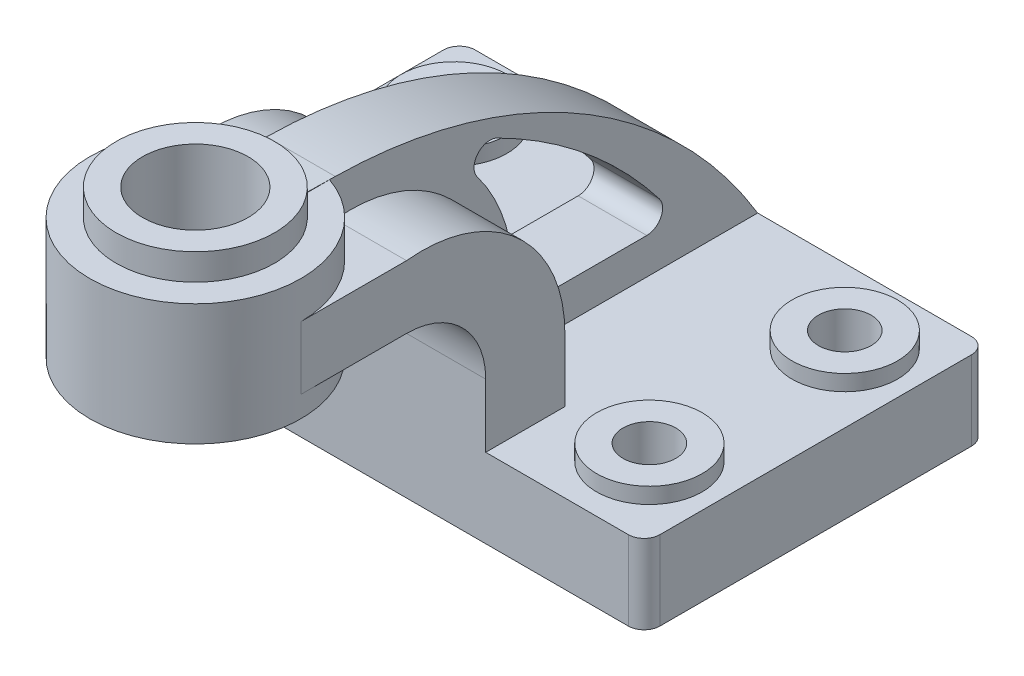
from build123d import *

# Parameters (mm, degrees)
SKETCH5_R                = 254
SKETCH5_R_2              = 127
BOSS_EXTRUDE2_DEPTH      = 381
BOSS_EXTRUDE3_START      = 76.2
SKETCH5_5_R              = 254
SKETCH5_5_R_2            = 127
BOSS_EXTRUDE3_DEPTH      = 76.2
SKETCH6_R                = 508
SKETCH6_R_2              = 381
BOSS_EXTRUDE4_DEPTH      = 584.2
BOSS_EXTRUDE5_DEPTH      = 127
BOSS_EXTRUDE5_DEPTH_BACK = 584.2
BOSS_EXTRUDE6_DEPTH      = 508
BOSS_EXTRUDE6_DEPTH_BACK = 508
CUT_EXTRUDE1_DEPTH       = 2904.34744305
RIB1_START               = -165.1
RIB1_DEPTH               = 330.2
CUT_EXTRUDE2_DEPTH       = 508
CUT_EXTRUDE2_DEPTH_BACK  = 508


# Read off the part's stored shape, not the designer's step: Rib1
with BuildPart() as part:
    # Sketch5 → Boss-Extrude2 (new body)
    # profile 1 of 5: a face of its own
    with BuildSketch(Plane(origin=(0, 0, 0), x_dir=(1, 0, 0), z_dir=(0, 1, 0))):
        with BuildLine():
            Line((-1193.8, -825.5), (1193.8, -825.5))
            ThreePointArc((1193.8, -825.5), (1247.681536726, -803.181536726), (1270, -749.3))
            Line((1270, -749.3), (1270, 749.3))
            ThreePointArc((1270, 749.3), (1247.681536726, 803.181536726), (1193.8, 825.5))
            Line((1193.8, 825.5), (-1193.8, 825.5))
            ThreePointArc((-1193.8, 825.5), (-1247.681536726, 803.181536726), (-1270, 749.3))
            Line((-1270, 749.3), (-1270, -749.3))
            ThreePointArc((-1270, -749.3), (-1247.681536726, -803.181536726), (-1193.8, -825.5))
        make_face()
        with Locations((939.8, -469.9)):
            Circle(SKETCH5_R, mode=Mode.SUBTRACT)
        with Locations((-939.8, 469.9)):
            Circle(SKETCH5_R, mode=Mode.SUBTRACT)
        with Locations((939.8, 469.9)):
            Circle(SKETCH5_R, mode=Mode.SUBTRACT)
        with Locations((-939.8, -469.9)):
            Circle(SKETCH5_R, mode=Mode.SUBTRACT)
    # profile 2 of 5: a face of its own
    with BuildSketch(Plane(origin=(0, 0, 0), x_dir=(1, 0, 0), z_dir=(0, 1, 0))):
        with Locations((-939.8, 469.9)):
            Circle(SKETCH5_R)
        with Locations(Location((-939.8, 469.9, 0), (0, 0, 270))):
            Circle(SKETCH5_R_2, mode=Mode.SUBTRACT)
    # profile 3 of 5: a face of its own
    with BuildSketch(Plane(origin=(0, 0, 0), x_dir=(1, 0, 0), z_dir=(0, 1, 0))):
        with Locations((-939.8, -469.9)):
            Circle(SKETCH5_R)
        with Locations(Location((-939.8, -469.9, 0), (0, 0, 270))):
            Circle(SKETCH5_R_2, mode=Mode.SUBTRACT)
    # profile 4 of 5: a face of its own
    with BuildSketch(Plane(origin=(0, 0, 0), x_dir=(1, 0, 0), z_dir=(0, 1, 0))):
        with Locations((939.8, -469.9)):
            Circle(SKETCH5_R)
        with Locations(Location((939.8, -469.9, 0), (0, 0, 270))):
            Circle(SKETCH5_R_2, mode=Mode.SUBTRACT)
    # profile 5 of 5: a face of its own
    with BuildSketch(Plane(origin=(0, 0, 0), x_dir=(1, 0, 0), z_dir=(0, 1, 0))):
        with Locations((939.8, 469.9)):
            Circle(SKETCH5_R)
        with Locations(Location((939.8, 469.9, 0), (0, 0, 270))):
            Circle(SKETCH5_R_2, mode=Mode.SUBTRACT)
    extrude(amount=-BOSS_EXTRUDE2_DEPTH)

    # Sketch5<5> → Boss-Extrude3 (add)
    # profile 1 of 4: a face of its own
    with BuildSketch(Plane(origin=(0, 0, 0), x_dir=(1, 0, 0), z_dir=(0, 1, 0)).offset(BOSS_EXTRUDE3_START)):
        with Locations(Location((-939.8, 469.9, 0), (0, 0, 90))):
            Circle(SKETCH5_5_R)
        with Locations(Location((-939.8, 469.9, 0), (0, 0, 270))):
            Circle(SKETCH5_5_R_2, mode=Mode.SUBTRACT)
    # profile 2 of 4: a face of its own
    with BuildSketch(Plane(origin=(0, 0, 0), x_dir=(1, 0, 0), z_dir=(0, 1, 0)).offset(BOSS_EXTRUDE3_START)):
        with Locations(Location((-939.8, -469.9, 0), (0, 0, 90))):
            Circle(SKETCH5_5_R)
        with Locations(Location((-939.8, -469.9, 0), (0, 0, 270))):
            Circle(SKETCH5_5_R_2, mode=Mode.SUBTRACT)
    # profile 3 of 4: a face of its own
    with BuildSketch(Plane(origin=(0, 0, 0), x_dir=(1, 0, 0), z_dir=(0, 1, 0)).offset(BOSS_EXTRUDE3_START)):
        with Locations(Location((939.8, 469.9, 0), (0, 0, 90))):
            Circle(SKETCH5_5_R)
        with Locations(Location((939.8, 469.9, 0), (0, 0, 270))):
            Circle(SKETCH5_5_R_2, mode=Mode.SUBTRACT)
    # profile 4 of 4: a face of its own
    with BuildSketch(Plane(origin=(0, 0, 0), x_dir=(1, 0, 0), z_dir=(0, 1, 0)).offset(BOSS_EXTRUDE3_START)):
        with Locations(Location((939.8, -469.9, 0), (0, 0, 90))):
            Circle(SKETCH5_5_R)
        with Locations(Location((939.8, -469.9, 0), (0, 0, 270))):
            Circle(SKETCH5_5_R_2, mode=Mode.SUBTRACT)
    extrude(amount=-BOSS_EXTRUDE3_DEPTH)



with BuildPart() as body_2:
    # Sketch6 → Boss-Extrude4 (new body)
    with BuildSketch(Plane(origin=(0, 1168.4, 0), x_dir=(1, 0, 0), z_dir=(0, 1, 0))):
        with Locations(Location((0, -1714.5, 0), (0, 0, 270))):
            Circle(SKETCH6_R)
        with Locations(Location((0, -1714.5, 0), (0, 0, 270))):
            Circle(SKETCH6_R_2, mode=Mode.SUBTRACT)
    extrude(amount=-BOSS_EXTRUDE4_DEPTH)

    # Sketch6<5> → Boss-Extrude5 (add, two sides: drawn at the far end of the back side and taken through both)
    with BuildSketch(Plane(origin=(0, 1168.4, 0), x_dir=(1, 0, 0), z_dir=(0, 1, 0)).offset(-BOSS_EXTRUDE5_DEPTH_BACK)):
        with BuildLine():
            ThreePointArc((381, -1714.5), (269.407683632, -1445.092316368), (0, -1333.5))
            Line((0, -1333.5), (0, -1460.5))
            ThreePointArc((0, -1460.5), (179.605122421, -1534.894877579), (254, -1714.5))
            ThreePointArc((254, -1714.5), (179.605122421, -1894.105122421), (0, -1968.5))
            Line((0, -1968.5), (0, -2095.5))
            ThreePointArc((0, -2095.5), (269.407683632, -1983.907683632), (381, -1714.5))
        make_face()
        with BuildLine():
            Line((0, -1460.5), (0, -1333.5))
            ThreePointArc((0, -1333.5), (-381, -1714.5), (0, -2095.5))
            Line((0, -2095.5), (0, -1968.5))
            ThreePointArc((0, -1968.5), (-254, -1714.5), (0, -1460.5))
        make_face()
        with BuildLine():
            ThreePointArc((381, -1714.5), (269.407683632, -1445.092316368), (0, -1333.5))
            Line((0, -1333.5), (0, -1460.5))
            ThreePointArc((0, -1460.5), (179.605122421, -1534.894877579), (254, -1714.5))
            ThreePointArc((254, -1714.5), (179.605122421, -1894.105122421), (0, -1968.5))
            Line((0, -1968.5), (0, -2095.5))
            ThreePointArc((0, -2095.5), (269.407683632, -1983.907683632), (381, -1714.5))
        make_face()
        with BuildLine():
            Line((0, -1460.5), (0, -1333.5))
            ThreePointArc((0, -1333.5), (-381, -1714.5), (0, -2095.5))
            Line((0, -2095.5), (0, -1968.5))
            ThreePointArc((0, -1968.5), (-254, -1714.5), (0, -1460.5))
        make_face()
    extrude(amount=BOSS_EXTRUDE5_DEPTH + BOSS_EXTRUDE5_DEPTH_BACK)


with BuildPart() as part_1:
    add(part.part)

    add(body_2.part)  # Boss-Extrude6 merges body 2
    # Sketch11 → Boss-Extrude6 (add, two sides: drawn at the far end of the back side and taken through both)
    with BuildSketch(Plane(origin=(0, 0, 0), x_dir=(0, 0, -1), z_dir=(1, 0, 0)).offset(-BOSS_EXTRUDE6_DEPTH_BACK)):
        with BuildLine():
            Line((-825.5, 0), (-825.5, 304.8))
            ThreePointArc((-825.5, 304.8), (-937.092316368, 574.207683632), (-1206.5, 685.8))
            Line((-1206.5, 685.8), (-1714.5, 685.8))
            Line((-1714.5, 685.8), (-1714.5, 989.043840563))
            Line((-1714.5, 989.043840563), (-1206.5, 989.043840563))
            ThreePointArc((-1206.5, 989.043840563), (-672.998317557, 816.80529258), (-444.654841735, 304.8))
            Line((-444.654841735, 304.8), (-444.654841735, 0))
            Line((-444.654841735, 0), (-825.5, 0))
        make_face()
    extrude(amount=BOSS_EXTRUDE6_DEPTH + BOSS_EXTRUDE6_DEPTH_BACK)

    # Sketch12 → Cut-Extrude1 (cut, through all)
    with BuildSketch(Plane(origin=(0, 989.043840563, 0), x_dir=(1, 0, 0), z_dir=(0, 1, 0))):
        with BuildLine():
            Line((-254, -1714.5), (254, -1714.5))
            ThreePointArc((254, -1714.5), (0, -1460.5), (-254, -1714.5))
        make_face()
    extrude(amount=-CUT_EXTRUDE1_DEPTH, mode=Mode.SUBTRACT)

    # Rib1 outline → Rib1 (add)
    with BuildSketch(Plane(origin=(0, 0, 0), x_dir=(0, 0, -1), z_dir=(1, 0, 0)).offset(RIB1_START)):
        with BuildLine():
            Line((-1373, 1170.843638094), (-1373, 971.12248932))
            Line((-1373, 971.12248932), (-1206.5, 989.043840563))
            ThreePointArc((-1206.5, 989.043840563), (-672.998317557, 816.80529258), (-444.654841735, 304.8))
            Line((-444.654841735, 304.8), (-444.654841735, 0))
            Line((-444.654841735, 0), (825.5, 0))
            ThreePointArc((825.5, 0), (-39.099770382, 847.504747162), (-1206.5, 1168.4))
            Line((-1206.5, 1168.4), (-1371.129951801, 1170.816192322))
            Line((-1371.129951801, 1170.816192322), (-1373, 1170.843638094))
        make_face()
    extrude(amount=RIB1_DEPTH)

    # Sketch15 → Cut-Extrude2 (cut, two sides: drawn at the far end of the back side and taken through both)
    with BuildSketch(Plane(origin=(0, 0, 0), x_dir=(0, 0, -1), z_dir=(1, 0, 0)).offset(-CUT_EXTRUDE2_DEPTH_BACK)):
        with BuildLine():
            Line((292.172139573, 173.059996376), (-274.471730256, 173.059996376))
            ThreePointArc((-274.471730256, 173.059996376), (-329.922551519, 196.994841433), (-350.538548236, 253.763239913))
            ThreePointArc((-350.538548236, 253.763239913), (-386.044795403, 554.926490817), (-523.471382692, 825.24839224))
            ThreePointArc((-523.471382692, 825.24839224), (-521.253789027, 919.88991283), (-428.604921426, 939.335284348))
            ThreePointArc((-428.604921426, 939.335284348), (-1.537872903, 661.814311273), (352.562032735, 295.730425725))
            ThreePointArc((352.562032735, 295.730425725), (360.536921136, 215.604437522), (292.172139573, 173.059996376))
        make_face()
    extrude(amount=CUT_EXTRUDE2_DEPTH + CUT_EXTRUDE2_DEPTH_BACK, mode=Mode.SUBTRACT)


solid = part_1.part
